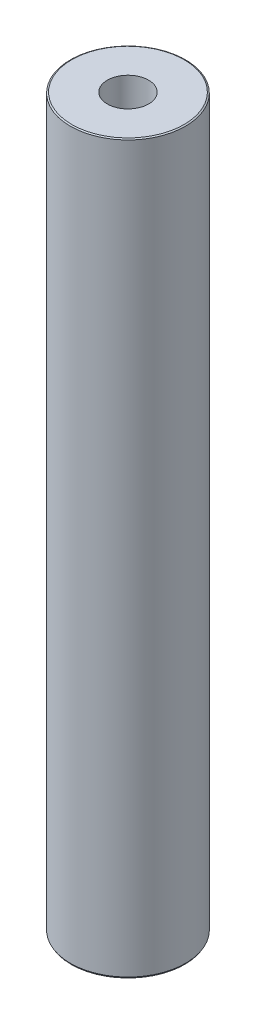
from build123d import *
from OCP.BRepFilletAPI import BRepFilletAPI_MakeChamfer

# Parameters (mm, degrees)
SKETCH1_R           = 47.5
BOSS_EXTRUDE1_DEPTH = 600
SKETCH2_R           = 17.057754246
CUT_EXTRUDE1_DEPTH  = 604.748706003
CHAMFER1_SIZE       = 0.657041149
CHAMFER1_SIZE2      = 1.138028652


with BuildPart() as part:
    # Sketch1 → Boss-Extrude1 (new body)
    with BuildSketch(Plane(origin=(0, 0, 0), x_dir=(1, 0, 0), z_dir=(0, 1, 0))):
        Circle(SKETCH1_R)
    extrude(amount=BOSS_EXTRUDE1_DEPTH)

    # Sketch2 → Cut-Extrude1 (cut, through all)
    with BuildSketch(Plane(origin=(0, 0, 0), x_dir=(1, 0, 0), z_dir=(0, 1, 0))):
        Circle(SKETCH2_R)
    extrude(amount=CUT_EXTRUDE1_DEPTH, mode=Mode.SUBTRACT)

    # Chamfer1: one chamfer whose edges measure the first distance from different faces: ONE call of the kernel's chamfer builder (chamfer() names one face for all edges)
    chamfer1_edges_1 = [part.edges().sort_by_distance(p)[0] for p in [
        (-47.5, 600, 0),
    ]]
    chamfer1_side_1 = [part.faces().sort_by_distance(p)[0] for p in [
        (-47.5, 300, 0),
    ]]
    chamfer1_edges_2 = [part.edges().sort_by_distance(p)[0] for p in [
        (-47.5, 0, 0),
    ]]
    chamfer1_side_2 = [part.faces().sort_by_distance(p)[0] for p in [
        (-46.156497116, 0, 0),
    ]]
    chamfer1 = BRepFilletAPI_MakeChamfer(part.part.solid().wrapped)
    for e in chamfer1_edges_1:
        chamfer1.Add(CHAMFER1_SIZE, CHAMFER1_SIZE2, e.wrapped, chamfer1_side_1[0].wrapped)  # the first distance lies on this face
    for e in chamfer1_edges_2:
        chamfer1.Add(CHAMFER1_SIZE, CHAMFER1_SIZE2, e.wrapped, chamfer1_side_2[0].wrapped)  # the first distance lies on this face
    add(Compound.cast(chamfer1.Shape()), mode=Mode.REPLACE)


solid = part.part
